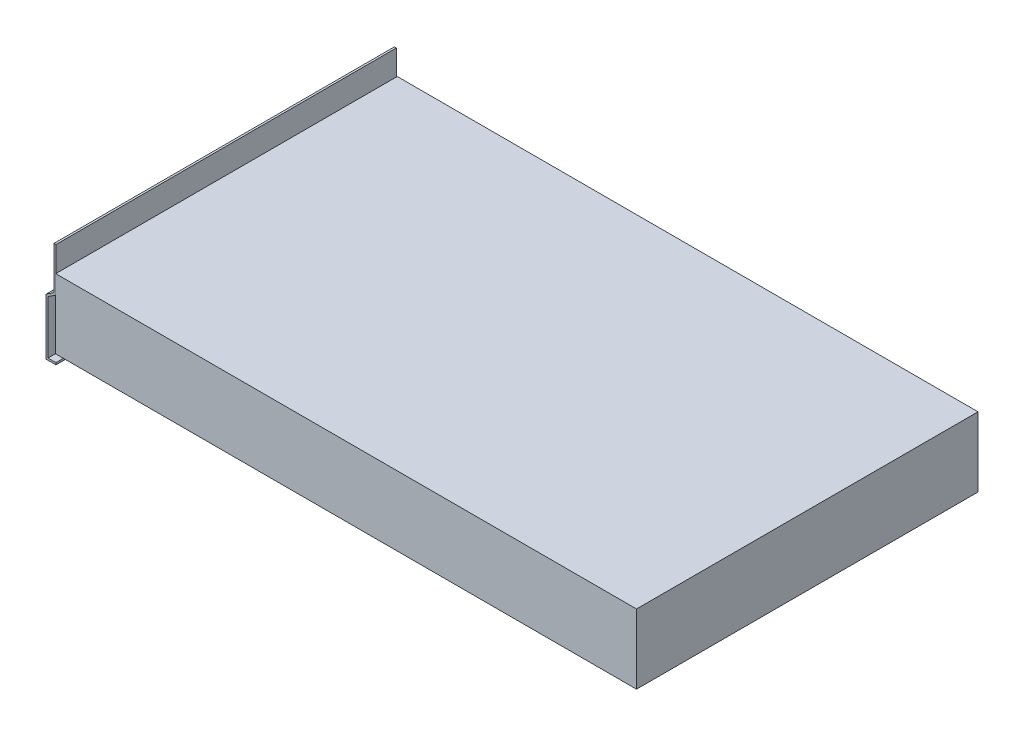
from build123d import *

# Parameters (mm, degrees)
EXTRUDE_1_OUTLINE_W     = 585
EXTRUDE_1_OUTLINE_H     = 344
EXTRUDE_1_DEPTH         = 1.5
EXTRUDE_START           = 68.5
EXTRUDE_1_2_OUTLINE_W   = 585
EXTRUDE_1_2_OUTLINE_H   = 344
EXTRUDE_1_2_DEPTH       = 1.5
EXTRUDE_START_2         = 1.5
EXTRUDE_1_3_OUTLINE_W   = 585
EXTRUDE_1_3_OUTLINE_H   = 344
EXTRUDE_1_3_OUTLINE_W_2 = 582
EXTRUDE_1_3_OUTLINE_H_2 = 341
EXTRUDE_1_3_DEPTH       = 67
EXTRUDE_2_DEPTH         = 171.5


# Read off the part's stored shape, not the designer's step: Вытянуть-Тонкостенный1
with BuildPart() as part:
    # Вытянуть-Тонкостенный1 outline → Вытянуть-Тонкостенный1 (new body)
    with BuildSketch(Plane(origin=(0, 0, 0), x_dir=(1, 0, 0), z_dir=(0, 1, 0))):
        with Locations((292.810788, 0)):
            Rectangle(EXTRUDE_1_OUTLINE_W, EXTRUDE_1_OUTLINE_H)
    extrude(amount=EXTRUDE_1_DEPTH)



with BuildPart() as body_2:
    # Extrude 1 2 outline → Extrude 1 2 (new body)
    with BuildSketch(Plane(origin=(0, 0, 0), x_dir=(1, 0, 0), z_dir=(0, 1, 0)).offset(EXTRUDE_START)):
        with Locations((292.810788, 0)):
            Rectangle(EXTRUDE_1_2_OUTLINE_W, EXTRUDE_1_2_OUTLINE_H)
    extrude(amount=EXTRUDE_1_2_DEPTH)


with BuildPart() as part_1:
    add(part.part)

    add(body_2.part)  # Extrude 1 3 merges body 2
    # Extrude 1 3 outline → Extrude 1 3 (add)
    with BuildSketch(Plane(origin=(0, 0, 0), x_dir=(1, 0, 0), z_dir=(0, 1, 0)).offset(EXTRUDE_START_2)):
        with Locations((292.810788, 0)):
            Rectangle(EXTRUDE_1_3_OUTLINE_W, EXTRUDE_1_3_OUTLINE_H)
        with Locations((292.810788, 0)):
            Rectangle(EXTRUDE_1_3_OUTLINE_W_2, EXTRUDE_1_3_OUTLINE_H_2, mode=Mode.SUBTRACT)
    extrude(amount=EXTRUDE_1_3_DEPTH)


with BuildPart() as body_2_2:
    # Эскиз2 → Вытянуть-Тонкостенный2 (new, symmetric)
    with BuildSketch(Plane.XY):
        Polygon((0, -10), (-10, -10), (-10, 46.678122215), (-2, 52), (-2, 95), (0, 95), (0, 50.928356013), (-8, 45.606478228), (-8, -8), (0, -8), align=None)
    extrude(amount=EXTRUDE_2_DEPTH, both=True)


solid = Compound([part_1.part, body_2_2.part])
